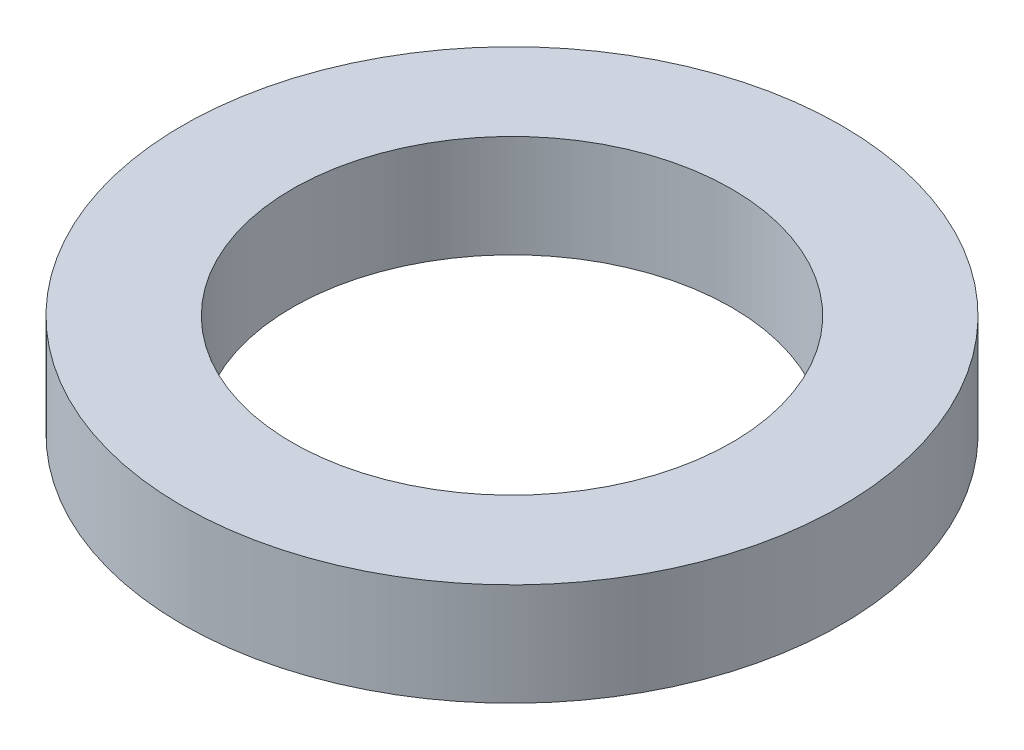
from build123d import *

# Parameters (mm, degrees)
SKETCH1_R           = 67.5
BOSS_EXTRUDE1_DEPTH = 21
SKETCH2_R           = 45
CUT_EXTRUDE1_DEPTH  = 98.742007346


with BuildPart() as part:
    # Sketch1 → Boss-Extrude1 (new body)
    with BuildSketch(Plane(origin=(0, 0, 0), x_dir=(1, 0, 0), z_dir=(0, 1, 0))):
        Circle(SKETCH1_R)
    extrude(amount=BOSS_EXTRUDE1_DEPTH)

    # Sketch2 → Cut-Extrude1 (cut, through all)
    with BuildSketch(Plane(origin=(0, 0, 0), x_dir=(1, 0, 0), z_dir=(0, 1, 0))):
        Circle(SKETCH2_R)
    extrude(amount=CUT_EXTRUDE1_DEPTH, mode=Mode.SUBTRACT)


solid = part.part
